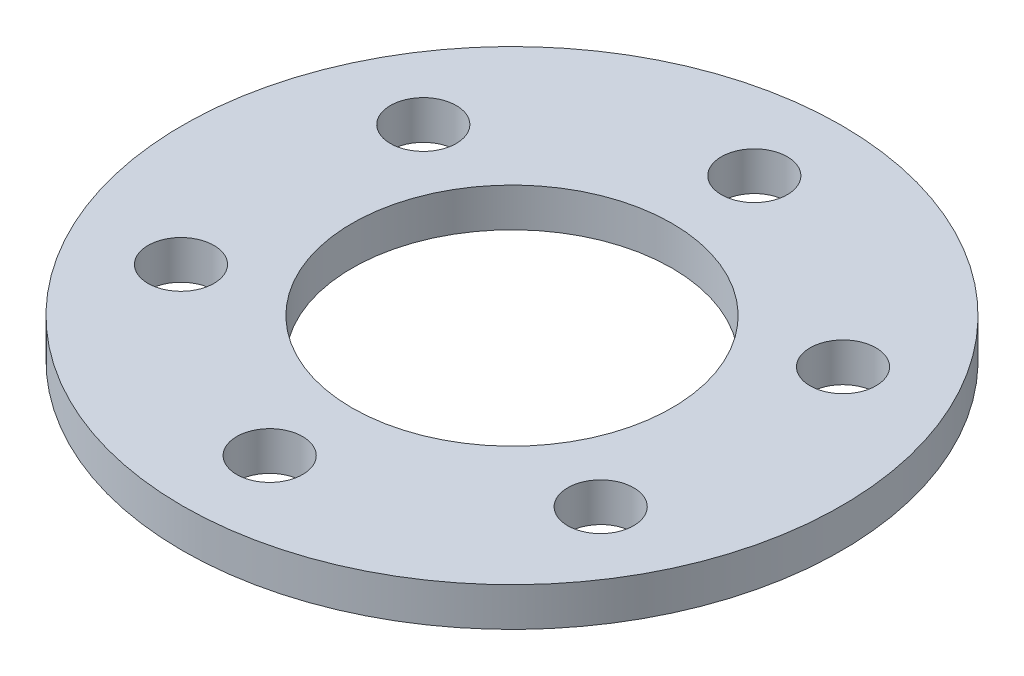
from build123d import *

# Parameters (mm, degrees)
SKETCH1_R           = 17
SKETCH1_R_2         = 8.25
SKETCH1_R_3         = 1.7
BOSS_EXTRUDE1_DEPTH = 2


with BuildPart() as part:
    # Sketch1 → Boss-Extrude1 (new body)
    with BuildSketch(Plane(origin=(0, 0, 0), x_dir=(1, 0, 0), z_dir=(0, 1, 0))):
        Circle(SKETCH1_R)
        Circle(SKETCH1_R_2, mode=Mode.SUBTRACT)
        with Locations((0, 12.5)):
            Circle(SKETCH1_R_3, mode=Mode.SUBTRACT)
        with Locations((10.825317547, 6.25)):
            Circle(SKETCH1_R_3, mode=Mode.SUBTRACT)
        with Locations((10.825317547, -6.25)):
            Circle(SKETCH1_R_3, mode=Mode.SUBTRACT)
        with Locations((0, -12.5)):
            Circle(SKETCH1_R_3, mode=Mode.SUBTRACT)
        with Locations((-10.825317547, -6.25)):
            Circle(SKETCH1_R_3, mode=Mode.SUBTRACT)
        with Locations((-10.825317547, 6.25)):
            Circle(SKETCH1_R_3, mode=Mode.SUBTRACT)
    extrude(amount=BOSS_EXTRUDE1_DEPTH)


solid = part.part
